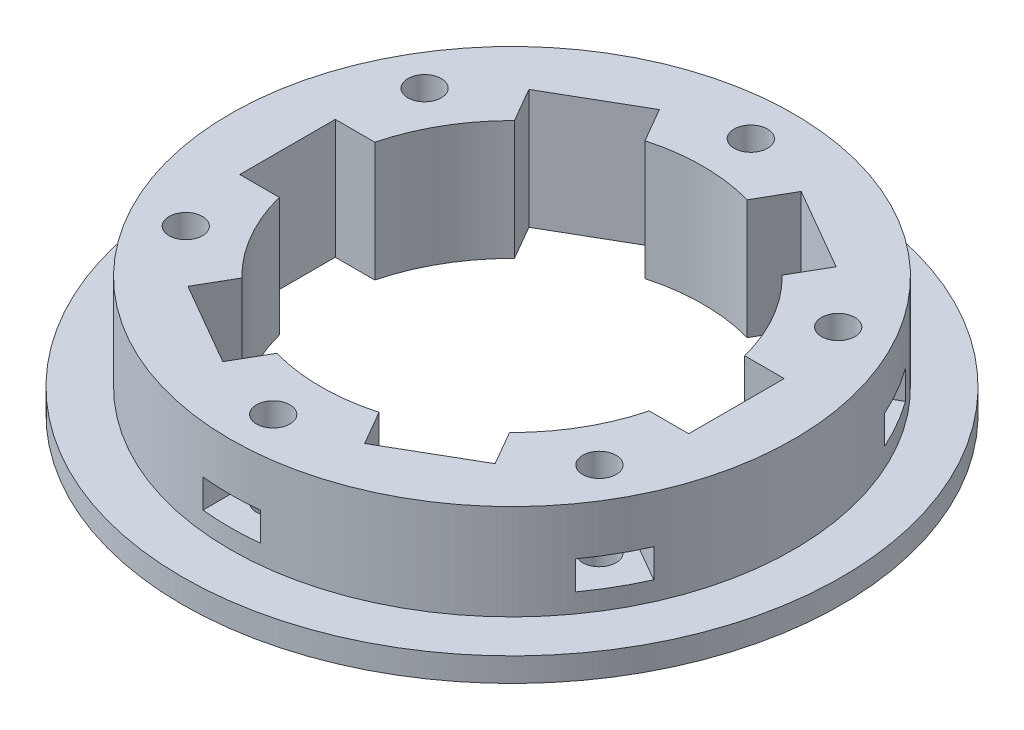
from build123d import *

# Parameters (mm, degrees)
SKETCH1_R           = 34.5
SKETCH1_R_2         = 20
BOSS_EXTRUDE1_DEPTH = 2.5
SKETCH2_R           = 29.5
SKETCH2_R_2         = 20
BOSS_EXTRUDE2_DEPTH = 10
SKETCH4_R           = 1.75
CUT_EXTRUDE2_DEPTH  = 51.366159274
CUT_EXTRUDE1_DEPTH  = 51.366159274
CUT_EXTRUDE3_START  = -3
CUT_EXTRUDE3_DEPTH  = 3


with BuildPart() as part:
    # Sketch1 → Boss-Extrude1 (new body)
    with BuildSketch(Plane(origin=(0, 0, 0), x_dir=(1, 0, 0), z_dir=(0, 1, 0))):
        Circle(SKETCH1_R)
        Circle(SKETCH1_R_2, mode=Mode.SUBTRACT)
    extrude(amount=BOSS_EXTRUDE1_DEPTH)

    # Sketch2 → Boss-Extrude2 (add)
    with BuildSketch(Plane(origin=(0, 2.5, 0), x_dir=(1, 0, 0), z_dir=(0, 1, 0))):
        Circle(SKETCH2_R)
        Circle(SKETCH2_R_2, mode=Mode.SUBTRACT)
    extrude(amount=BOSS_EXTRUDE2_DEPTH)

    # Sketch4 → Cut-Extrude2 (cut, through all)
    with BuildSketch(Plane(origin=(0, 12.5, 0), x_dir=(1, 0, 0), z_dir=(0, 1, 0))):
        with Locations((-21.650635095, -12.5)):
            Circle(SKETCH4_R)
        with Locations((-21.650635095, 12.5)):
            Circle(SKETCH4_R)
        with Locations((0, 25)):
            Circle(SKETCH4_R)
        with Locations((21.650635095, 12.5)):
            Circle(SKETCH4_R)
        with Locations((21.650635095, -12.5)):
            Circle(SKETCH4_R)
        with Locations((0, -25)):
            Circle(SKETCH4_R)
    extrude(amount=-CUT_EXTRUDE2_DEPTH, mode=Mode.SUBTRACT)

    # Sketch3 → Cut-Extrude1 (cut, through all)
    with BuildSketch(Plane(origin=(0, 12.5, 0), x_dir=(1, 0, 0), z_dir=(0, 1, 0))):
        with BuildLine():
            Line((-19.364916731, 5), (-23.5, 5))
            Line((-23.5, 5), (-23.5, -5))
            Line((-23.5, -5), (-19.364916731, -5))
            ThreePointArc((-19.364916731, -5), (-20, 0), (-19.364916731, 5))
        make_face()
        with BuildLine():
            Line((-5.352331347, 19.270509831), (-7.419872981, 22.851596989))
            Line((-7.419872981, 22.851596989), (-16.080127019, 17.851596989))
            Line((-16.080127019, 17.851596989), (-14.012585384, 14.270509831))
            ThreePointArc((-14.012585384, 14.270509831), (-10, 17.320508076), (-5.352331347, 19.270509831))
        make_face()
        with BuildLine():
            Line((14.012585384, 14.270509831), (16.080127019, 17.851596989))
            Line((16.080127019, 17.851596989), (7.419872981, 22.851596989))
            Line((7.419872981, 22.851596989), (5.352331347, 19.270509831))
            ThreePointArc((5.352331347, 19.270509831), (10, 17.320508076), (14.012585384, 14.270509831))
        make_face()
        with BuildLine():
            Line((19.364916731, -5), (23.5, -5))
            Line((23.5, -5), (23.5, 5))
            Line((23.5, 5), (19.364916731, 5))
            ThreePointArc((19.364916731, 5), (20, 0), (19.364916731, -5))
        make_face()
        with BuildLine():
            Line((5.352331347, -19.270509831), (7.419872981, -22.851596989))
            Line((7.419872981, -22.851596989), (16.080127019, -17.851596989))
            Line((16.080127019, -17.851596989), (14.012585384, -14.270509831))
            ThreePointArc((14.012585384, -14.270509831), (10, -17.320508076), (5.352331347, -19.270509831))
        make_face()
        with BuildLine():
            Line((-14.012585384, -14.270509831), (-16.080127019, -17.851596989))
            Line((-16.080127019, -17.851596989), (-7.419872981, -22.851596989))
            Line((-7.419872981, -22.851596989), (-5.352331347, -19.270509831))
            ThreePointArc((-5.352331347, -19.270509831), (-10, -17.320508076), (-14.012585384, -14.270509831))
        make_face()
    extrude(amount=-CUT_EXTRUDE1_DEPTH, mode=Mode.SUBTRACT)

    # Sketch7 → Cut-Extrude3 (cut)
    with BuildSketch(Plane(origin=(0, 7.5, 0), x_dir=(1, 0, 0), z_dir=(0, 1, 0)).offset(CUT_EXTRUDE3_START)):
        with BuildLine():
            Line((-18.650635095, -10.767949192), (-21.650635095, -9.035898385))
            Line((-21.650635095, -9.035898385), (-26.91530051, -12.075454379))
            ThreePointArc((-26.91530051, -12.075454379), (-25.547749412, -14.75), (-23.91530051, -17.271606802))
            Line((-23.91530051, -17.271606802), (-18.650635095, -14.232050808))
            Line((-18.650635095, -14.232050808), (-18.650635095, -10.767949192))
        make_face()
        with BuildLine():
            Line((0, -21.535898385), (-3, -23.267949192))
            Line((-3, -23.267949192), (-3, -29.347061182))
            ThreePointArc((-3, -29.347061182), (0, -29.5), (3, -29.347061182))
            Line((3, -29.347061182), (3, -23.267949192))
            Line((3, -23.267949192), (0, -21.535898385))
        make_face()
        with BuildLine():
            Line((-18.650635095, 10.767949192), (-18.650635095, 14.232050808))
            Line((-18.650635095, 14.232050808), (-23.91530051, 17.271606802))
            ThreePointArc((-23.91530051, 17.271606802), (-25.547749412, 14.75), (-26.91530051, 12.075454379))
            Line((-26.91530051, 12.075454379), (-21.650635095, 9.035898385))
            Line((-21.650635095, 9.035898385), (-18.650635095, 10.767949192))
        make_face()
        with BuildLine():
            Line((0, 21.535898385), (3, 23.267949192))
            Line((3, 23.267949192), (3, 29.347061182))
            ThreePointArc((3, 29.347061182), (0, 29.5), (-3, 29.347061182))
            Line((-3, 29.347061182), (-3, 23.267949192))
            Line((-3, 23.267949192), (0, 21.535898385))
        make_face()
        with BuildLine():
            Line((18.650635095, 10.767949192), (21.650635095, 9.035898385))
            Line((21.650635095, 9.035898385), (26.91530051, 12.075454379))
            ThreePointArc((26.91530051, 12.075454379), (25.547749412, 14.75), (23.91530051, 17.271606802))
            Line((23.91530051, 17.271606802), (18.650635095, 14.232050808))
            Line((18.650635095, 14.232050808), (18.650635095, 10.767949192))
        make_face()
        with BuildLine():
            Line((18.650635095, -10.767949192), (18.650635095, -14.232050808))
            Line((18.650635095, -14.232050808), (23.91530051, -17.271606802))
            ThreePointArc((23.91530051, -17.271606802), (25.547749412, -14.75), (26.91530051, -12.075454379))
            Line((26.91530051, -12.075454379), (21.650635095, -9.035898385))
            Line((21.650635095, -9.035898385), (18.650635095, -10.767949192))
        make_face()
    extrude(amount=CUT_EXTRUDE3_DEPTH, mode=Mode.SUBTRACT)


solid = part.part
